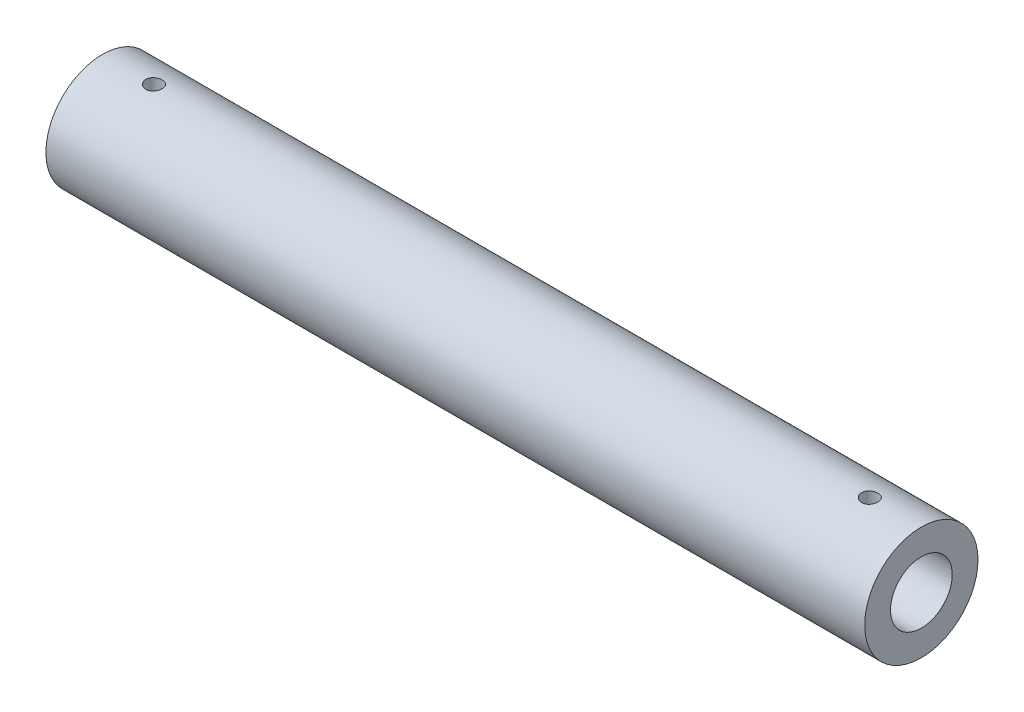
from build123d import *

# Parameters (mm, degrees)
SKETCH2_R               = 11
SKETCH2_R_2             = 6
BOSS_EXTRUDE1_DEPTH     = 158.975
CUT_EXTRUDE1_DEPTH      = 160.73431261
CUT_EXTRUDE1_DEPTH_BACK = 160.73431261
SKETCH3_R               = 1.5875


with BuildPart() as part:
    # Sketch2 → Boss-Extrude1 (new body)
    with BuildSketch(Plane(origin=(0, 0, 0), x_dir=(0, 0, -1), z_dir=(1, 0, 0))):
        Circle(SKETCH2_R)
        Circle(SKETCH2_R_2, mode=Mode.SUBTRACT)
    extrude(amount=BOSS_EXTRUDE1_DEPTH)

    # Sketch3 → Cut-Extrude1 (cut, two sides: drawn at the far end of the back side and taken through both)
    with BuildSketch(Plane(origin=(0, 0, 0), x_dir=(1, 0, 0), z_dir=(0, 1, 0)).offset(-CUT_EXTRUDE1_DEPTH_BACK)):
        with Locations((10, 0)):
            Circle(SKETCH3_R)
        with Locations((148.975, 0)):
            Circle(SKETCH3_R)
    extrude(amount=CUT_EXTRUDE1_DEPTH + CUT_EXTRUDE1_DEPTH_BACK, mode=Mode.SUBTRACT)


solid = part.part
